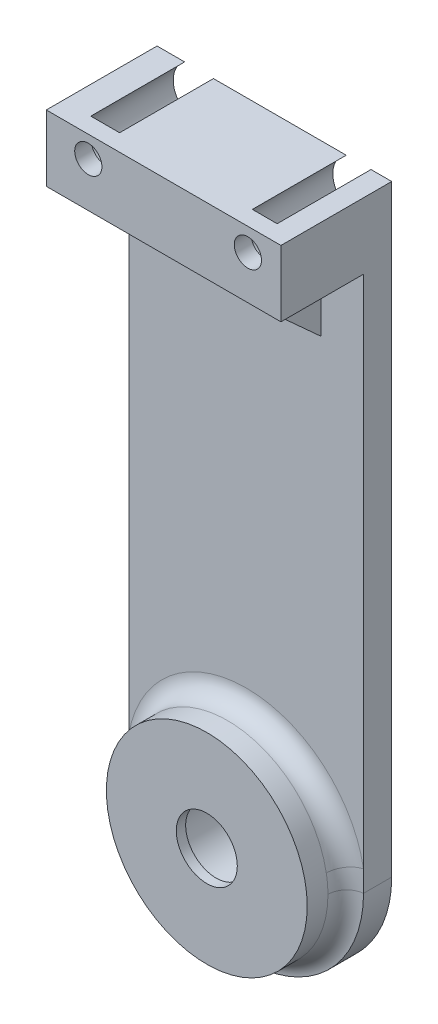
from build123d import *

# Parameters (mm, degrees)
ESBO_O2_R                           = 10.7
RESSALTO_EXTRUS_O1_DEPTH            = 4.2
RESSALTO_EXTRUS_O3_DEPTH            = 3
ESBO_O5_W                           = 25
ESBO_O5_H                           = 7.051040728
RESSALTO_EXTRUS_O4_DEPTH            = 11.8
REBAIXO_PARA_SHCS_M2_51_D           = 2.9
REBAIXO_PARA_SHCS_M2_51_CBORE_D     = 5.5
REBAIXO_PARA_SHCS_M2_51_CBORE_DEPTH = 10
NERVURA1_REACH                      = 67.976
ESBO_O10_WALL_W                     = 145.845066172
ESBO_O10_WALL_H                     = 15
CORTE_EXTRUS_O1_REACH               = 68.009
ESBO_O11_W                          = 9
ESBO_O11_H                          = 8
ESBO_O12_R                          = 3.25
CORTE_EXTRUS_O2_DEPTH               = 67.475439137
ESBO_O13_R                          = 4
CORTE_EXTRUS_O3_DEPTH               = 6.2
FILETE1_R                           = 2


with BuildPart() as part:
    # Esboço2 → Ressalto-extrusão1 (new body)
    with BuildSketch(Plane.XY.offset(-1.35)):
        with Locations((-0.474928023, -0.063425095)):
            Circle(ESBO_O2_R)
    extrude(amount=-RESSALTO_EXTRUS_O1_DEPTH)

    # Esboço4 → Ressalto-extrusão3 (add)
    with BuildSketch(Plane(origin=(0, 0, -5.55), x_dir=(-1, 0, 0), z_dir=(0, 0, -1))):
        with BuildLine():
            Line((-12.025071977, -0.063425095), (-12.025071977, 64.120162595))
            Line((-12.025071977, 64.120162595), (12.974928023, 64.120162595))
            Line((12.974928023, 64.120162595), (12.974928023, -0.063425095))
            ThreePointArc((12.974928023, -0.063425095), (0.474928023, -12.563425095), (-12.025071977, -0.063425095))
        make_face()
    extrude(amount=RESSALTO_EXTRUS_O3_DEPTH)

    # Esboço5 → Ressalto-extrusão4 (add)
    with BuildSketch(Plane(origin=(0, 0, -8.55), x_dir=(-1, 0, 0), z_dir=(0, 0, -1))):
        with Locations((0.474928023, 60.594642231)):
            Rectangle(ESBO_O5_W, ESBO_O5_H)
    extrude(amount=-RESSALTO_EXTRUS_O4_DEPTH)

    # Rebaixo para SHCS M2.51 (through all)
    with Locations(Plane(origin=(0, 0, -8.55), x_dir=(-1, 0, 0), z_dir=(0, 0, -1))):
        with Locations((-8.49949915, 61.707782077), (8.5, 61.838275999)):
            CounterBoreHole(REBAIXO_PARA_SHCS_M2_51_D / 2, REBAIXO_PARA_SHCS_M2_51_CBORE_D / 2, REBAIXO_PARA_SHCS_M2_51_CBORE_DEPTH)

    # Esboço10 wall → Nervura1 (add, up to next)
    with BuildSketch(Plane(origin=(0, 53.069121867, -1.15), x_dir=(0, -0.672672793996, -0.739940073396), z_dir=(0, 0.739940073396, -0.672672793996)), mode=Mode.PRIVATE) as nervura1_sk1:
        Rectangle(ESBO_O10_WALL_W, ESBO_O10_WALL_H)
    nervura1_tool1 = extrude(nervura1_sk1.sketch, amount=NERVURA1_REACH, mode=Mode.PRIVATE) - part.part
    add(nervura1_tool1.solids().sort_by_distance((0, 53.069121867, -1.15))[0])

    # Esboço11 → Corte-extrusão1 (cut, up to next)
    with BuildSketch(Plane.XY.offset(-5.55), mode=Mode.PRIVATE) as corte_extrus_o1_sk1:
        with Locations((0, 53.069121867)):
            Rectangle(ESBO_O11_W, ESBO_O11_H)
    corte_extrus_o1_tool1 = extrude(corte_extrus_o1_sk1.sketch, amount=CORTE_EXTRUS_O1_REACH, mode=Mode.PRIVATE) & part.part
    add(corte_extrus_o1_tool1.solids().sort_by_distance((0, 53.069122, -5.55))[0], mode=Mode.SUBTRACT)

    # Esboço12 → Corte-extrusão2 (cut, through all)
    with BuildSketch(Plane(origin=(0, 0, -8.55), x_dir=(-1, 0, 0), z_dir=(0, 0, -1))):
        with Locations((0.474928023, -0.063425095)):
            Circle(ESBO_O12_R)
    extrude(amount=-CORTE_EXTRUS_O2_DEPTH, mode=Mode.SUBTRACT)

    # Esboço13 → Corte-extrusão3 (cut)
    with BuildSketch(Plane(origin=(0, 0, -8.55), x_dir=(-1, 0, 0), z_dir=(0, 0, -1))):
        with Locations((0.474928023, -0.063425095)):
            Circle(ESBO_O13_R)
    extrude(amount=-CORTE_EXTRUS_O3_DEPTH, mode=Mode.SUBTRACT)

    # Filete1
    filete1_edges = [part.edges().sort_by_distance(p)[0] for p in [
        (-11.174928023, -0.063425095, -5.55),
    ]]
    fillet(filete1_edges, radius=FILETE1_R - 0.0001)  # a hair under: the kernel refuses the full size


solid = part.part
